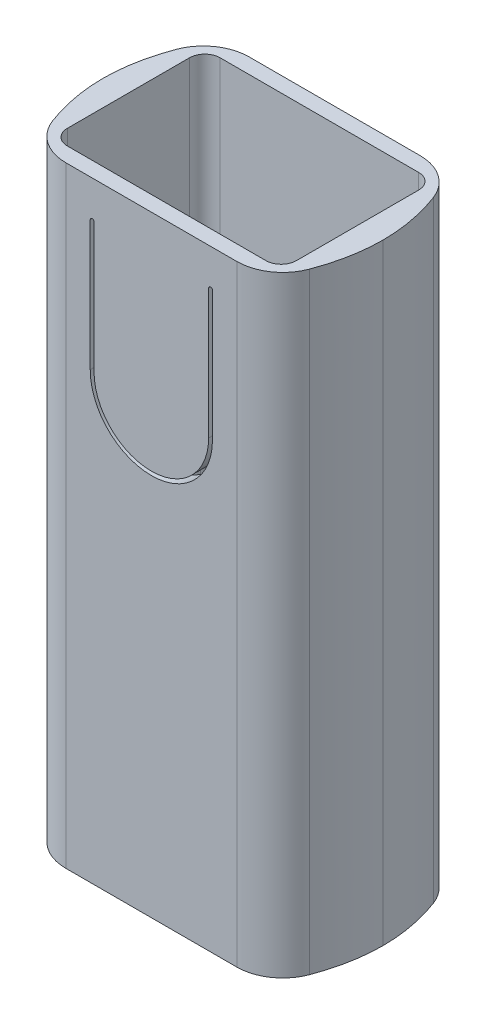
from build123d import *

# Parameters (mm, degrees)
BOSS_EXTRUDE4_DEPTH = 80
BOSS_EXTRUDE5_DEPTH = 57
CUT_EXTRUDE1_DEPTH  = 2
CHAMFER1_SIZE       = 2.83564091
CHAMFER1_SIZE_2     = 0.5


with BuildPart() as part:
    # Sketch8 → Boss-Extrude4 (new body)
    with BuildSketch(Plane(origin=(0, 58, 0), x_dir=(1, 0, 0), z_dir=(0, 1, 0))):
        with BuildLine():
            Line((-11.194828593, 12.000000011), (11.194828559, 12.000000011))
            ThreePointArc((11.194828559, 12.000000011), (14.611088941, 10.932460351), (16.811684841, 8.109721678))
            add(Edge.make_bspline(
                [(18.334712564, 1.1e-08), (18.327162677, 2.726130673), (17.819510816, 5.426517656), (16.811684841, 8.109721678)],
                knots=[0.502499344, 0.502499344, 0.502499344, 0.502499344, 0.837905074, 0.837905074, 0.837905074, 0.837905074], degree=3))
            add(Edge.make_bspline(
                [(18.334712564, 1.1e-08), (18.327162677, -2.72613065), (17.819510816, -5.426517634), (16.811684841, -8.109721656)],
                knots=[0.502499344, 0.502499344, 0.502499344, 0.502499344, 0.837905074, 0.837905074, 0.837905074, 0.837905074], degree=3))
            ThreePointArc((16.811684841, -8.109721656), (14.611088941, -10.932460328), (11.194828559, -11.999999989))
            Line((11.194828559, -11.999999989), (-11.194828593, -11.999999989))
            ThreePointArc((-11.194828593, -11.999999989), (-14.611088975, -10.932460328), (-16.811684874, -8.109721656))
            add(Edge.make_bspline(
                [(-18.334712598, 1.1e-08), (-18.327162711, -2.72613065), (-17.81951085, -5.426517634), (-16.811684874, -8.109721656)],
                knots=[0.502499344, 0.502499344, 0.502499344, 0.502499344, 0.837905074, 0.837905074, 0.837905074, 0.837905074], degree=3))
            add(Edge.make_bspline(
                [(-18.334712598, 1.1e-08), (-18.327162711, 2.726130673), (-17.81951085, 5.426517656), (-16.811684874, 8.109721678)],
                knots=[0.502499344, 0.502499344, 0.502499344, 0.502499344, 0.837905074, 0.837905074, 0.837905074, 0.837905074], degree=3))
            ThreePointArc((-16.811684874, 8.109721678), (-14.611088975, 10.932460351), (-11.194828593, 12.000000011))
        make_face()
        with BuildLine():
            Line((-15.000000017, -7.999999989), (-15.000000017, 8.000000011))
            ThreePointArc((-15.000000017, 8.000000011), (-14.414213579, 9.414213574), (-13.000000017, 10.000000011))
            Line((-13.000000017, 10.000000011), (12.999999983, 10.000000011))
            ThreePointArc((12.999999983, 10.000000011), (14.414213546, 9.414213574), (14.999999983, 8.000000011))
            Line((14.999999983, 8.000000011), (14.999999983, -7.999999989))
            ThreePointArc((14.999999983, -7.999999989), (14.414213546, -9.414213551), (12.999999983, -9.999999989))
            Line((12.999999983, -9.999999989), (-13.000000017, -9.999999989))
            ThreePointArc((-13.000000017, -9.999999989), (-14.414213579, -9.414213551), (-15.000000017, -7.999999989))
        make_face(mode=Mode.SUBTRACT)
    extrude(amount=BOSS_EXTRUDE4_DEPTH)

    # Sketch11 → Boss-Extrude5 (add)
    with BuildSketch(Plane(origin=(0, 58, 0), x_dir=(1, 0, 0), z_dir=(0, 1, 0))):
        with BuildLine():
            Line((13, 10.000000011), (15, 10.000000011))
            Line((15, 10.000000011), (15, 6.937911183))
            Line((15, 6.937911183), (13.5, 6.937911183))
            ThreePointArc((13.5, 6.937911183), (13.146446609, 7.084357793), (13, 7.437911183))
            Line((13, 7.437911183), (13, 10.000000011))
        make_face()
        with BuildLine():
            Line((-13, 7.437911183), (-13, 10.000000011))
            Line((-13, 10.000000011), (-15, 10.000000011))
            Line((-15, 10.000000011), (-15, 6.937911183))
            Line((-15, 6.937911183), (-13.5, 6.937911183))
            ThreePointArc((-13.5, 6.937911183), (-13.146446609, 7.084357793), (-13, 7.437911183))
        make_face()
    extrude(amount=BOSS_EXTRUDE5_DEPTH)

    # Sketch12 → Cut-Extrude1 (cut)
    with BuildSketch(Plane.XY.offset(11.999999989)):
        with BuildLine():
            Line((7.5, 133.134156445), (7.5, 116.134156445))
            ThreePointArc((7.5, 116.134156445), (0, 108.634156445), (-7.5, 116.134156445))
            Line((-7.5, 116.134156445), (-7.5, 133.134156445))
            ThreePointArc((-7.5, 133.134156445), (-7.75, 133.384156445), (-8, 133.134156445))
            Line((-8, 133.134156445), (-8, 116.134156445))
            ThreePointArc((-8, 116.134156445), (0, 108.134156445), (8, 116.134156445))
            Line((8, 116.134156445), (8, 133.134156445))
            ThreePointArc((8, 133.134156445), (7.75, 133.384156445), (7.5, 133.134156445))
        make_face()
    extrude(amount=-CUT_EXTRUDE1_DEPTH, mode=Mode.SUBTRACT)

    # Chamfer1
    # the kernel refuses this chamfer: 2.83564091, 0.5 mm, written as the material it takes off along each edge
    with BuildSketch(Plane(origin=(13, 115, -7.437911183), x_dir=(0, -1, 0), z_dir=(0, 0, -1))) as chamfer1_piece_1_section:
        Polygon((CHAMFER1_SIZE, 0), (0, -CHAMFER1_SIZE_2), (0, 0), align=None)
    chamfer1_piece_1 = extrude(amount=9.930611745, mode=Mode.PRIVATE)
    chamfer1_piece_1 = chamfer1_piece_1 & Plane(origin=(12.999999983, 115, -8.000000011), x_dir=(0, 0, -1), z_dir=(0, -1, 0)) * Cylinder(2, 32, mode=Mode.PRIVATE)
    add(chamfer1_piece_1, mode=Mode.SUBTRACT)
    with BuildSketch(Plane(origin=(13.5, 115, -7.437911183), x_dir=(0, 0, 1), z_dir=(1, 0, 0))) as chamfer1_piece_2:
        Polygon((0.5, CHAMFER1_SIZE), (0.5 - CHAMFER1_SIZE_2, 0), (0.5, 0), align=None)
    revolve(axis=Axis((13.5, 115, -7.437911183), (0, -1, 0)), revolution_arc=90, mode=Mode.SUBTRACT)
    with BuildSketch(Plane(origin=(15, 115, -6.937911183), x_dir=(0, -1, 0), z_dir=(-1, 0, 0))) as chamfer1_piece_3:
        Polygon((CHAMFER1_SIZE, 0), (0, -CHAMFER1_SIZE_2), (0, 0), align=None)
    extrude(amount=1.5, mode=Mode.SUBTRACT)
    with BuildSketch(Plane(origin=(-13, 115, -7.437911183), x_dir=(0, -1, 0), z_dir=(0, 0, -1))) as chamfer1_piece_4_section:
        Polygon((CHAMFER1_SIZE, 0), (0, CHAMFER1_SIZE_2), (0, 0), align=None)
    chamfer1_piece_4 = extrude(amount=9.930611745, mode=Mode.PRIVATE)
    chamfer1_piece_4 = chamfer1_piece_4 & Plane(origin=(-13.000000017, 115, -8.000000011), x_dir=(-1, 0, 0), z_dir=(0, -1, 0)) * Cylinder(2, 32, mode=Mode.PRIVATE)
    add(chamfer1_piece_4, mode=Mode.SUBTRACT)
    with BuildSketch(Plane(origin=(-15, 115, -6.937911183), x_dir=(0, -1, 0), z_dir=(1, 0, 0))) as chamfer1_piece_5:
        Polygon((CHAMFER1_SIZE, 0), (0, CHAMFER1_SIZE_2), (0, 0), align=None)
    extrude(amount=1.5, mode=Mode.SUBTRACT)
    with BuildSketch(Plane(origin=(-13.5, 115, -7.437911183), x_dir=(0, 0, 1), z_dir=(-1, 0, 0))) as chamfer1_piece_6:
        Polygon((0.5, -CHAMFER1_SIZE), (0.5 - CHAMFER1_SIZE_2, 0), (0.5, 0), align=None)
    revolve(axis=Axis((-13.5, 115, -7.437911183), (0, 1, 0)), revolution_arc=90, mode=Mode.SUBTRACT)


solid = part.part
